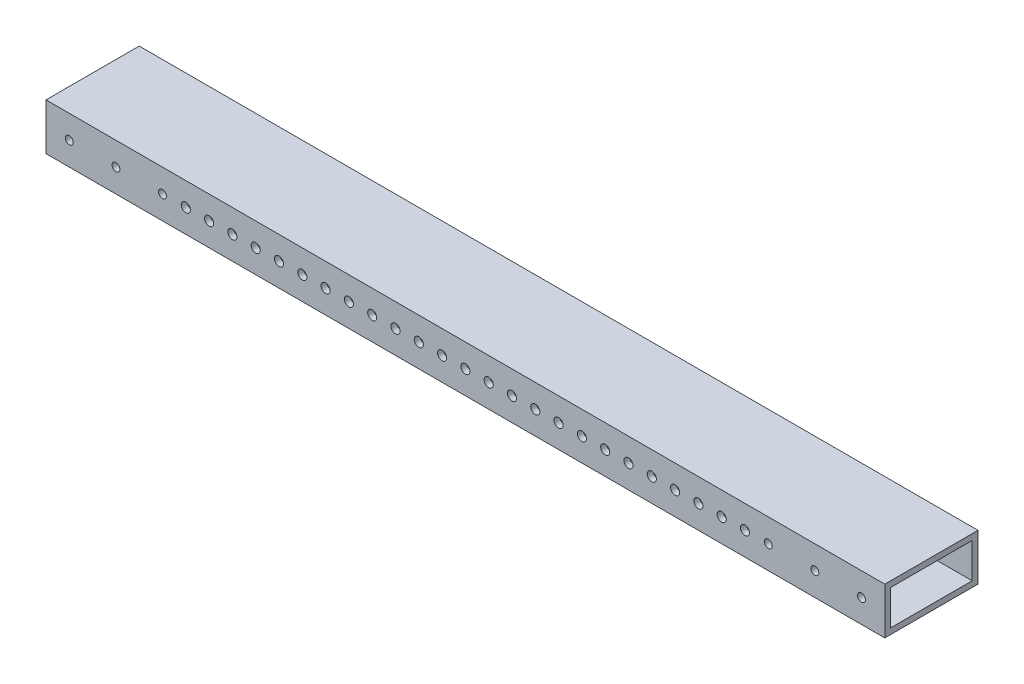
from build123d import *

# Parameters (mm, degrees)
SKETCH1_W           = 50.8
SKETCH1_H           = 25.4
BOSS_EXTRUDE1_DEPTH = 228.6
SHELL1_T            = -3.175
SKETCH2_R           = 2.15265
CUT_EXTRUDE1_DEPTH  = 236.549909786
SKETCH3_R           = 2.4892
CUT_EXTRUDE2_DEPTH  = 236.549909786
LPATTERN1_COUNT     = 25
LPATTERN1_PITCH     = 12.7


with BuildPart() as part:
    # Sketch1 → Boss-Extrude1 (new, symmetric)
    with BuildSketch(Plane(origin=(0, 0, 0), x_dir=(0, 0, -1), z_dir=(1, 0, 0))):
        with Locations((25.4, 12.7)):
            Rectangle(SKETCH1_W, SKETCH1_H)
    extrude(amount=BOSS_EXTRUDE1_DEPTH, both=True)

    # Shell1
    shell1_openings = [part.faces().sort_by_distance(p)[0] for p in [
        (228.6, 12.7, -25.4),
        (-228.6, 12.7, -25.4),
    ]]
    offset(amount=SHELL1_T, openings=shell1_openings, kind=Kind.INTERSECTION)

    # Sketch2 → Cut-Extrude1 (cut, through all)
    with BuildSketch(Plane.XY):
        with Locations((-215.9, 12.7)):
            Circle(SKETCH2_R)
        with Locations((-190.5, 12.7)):
            Circle(SKETCH2_R)
        with Locations((-165.1, 12.7)):
            Circle(SKETCH2_R)
    cut_extrude1 = extrude(amount=-CUT_EXTRUDE1_DEPTH, mode=Mode.SUBTRACT)

    # Sketch3 → Cut-Extrude2 (cut, through all)
    with BuildSketch(Plane.XY):
        with Locations((-152.4, 12.7)):
            Circle(SKETCH3_R)
    cut_extrude2 = extrude(amount=-CUT_EXTRUDE2_DEPTH, mode=Mode.SUBTRACT)

    # Mirror1: Cut-Extrude1 across plane
    add(cut_extrude1.mirror(Plane(origin=(0, 0, 0), x_dir=(0, 0, 1), z_dir=(1, 0, 0))), mode=Mode.SUBTRACT)

    # LPattern1: Cut-Extrude2 ×25
    with Locations(*[(i * LPATTERN1_PITCH, 0, 0) for i in range(1, LPATTERN1_COUNT)]):
        add(cut_extrude2, mode=Mode.SUBTRACT)


solid = part.part
